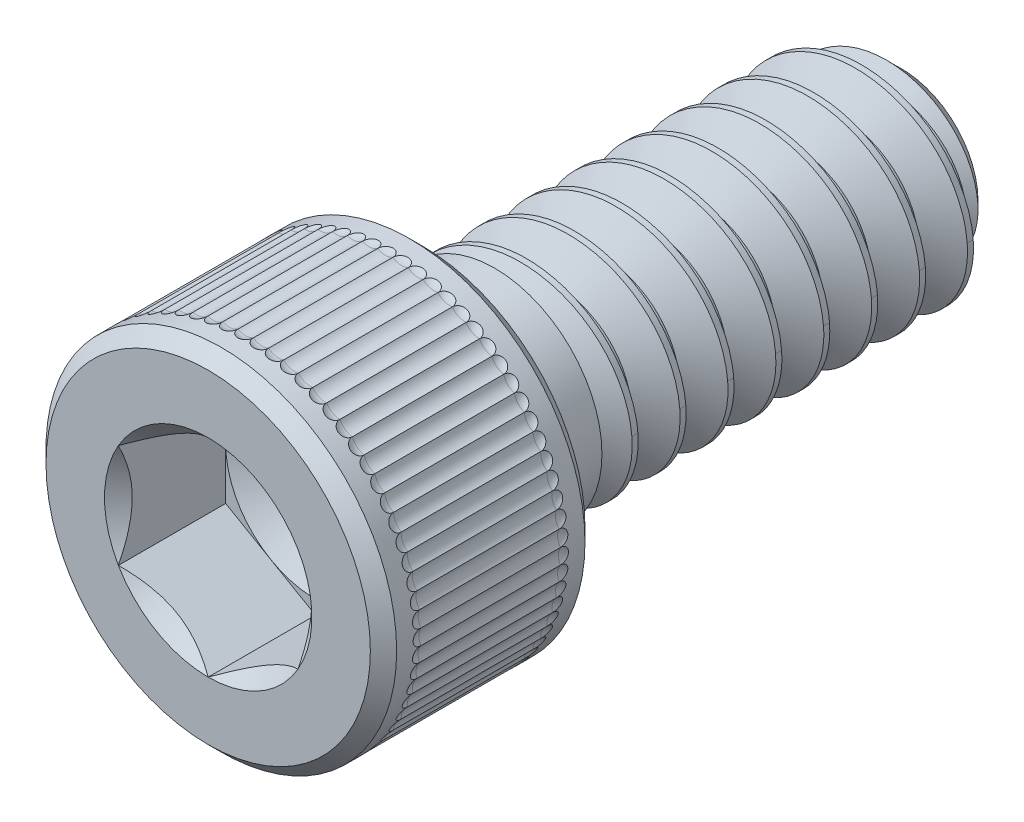
from build123d import *
from build123d.topology import SkipClean

# Parameters (mm, degrees)
CUT_EXTRUDE1_DEPTH = 1.4224
CUT_SWEEP1_PITCH   = 0.635
CIRPATTERN1_COUNT  = 72


with BuildPart() as part:
    # Sketch2 → Revolve1 (revolve)
    with BuildSketch(Plane(origin=(0, 0, 0), x_dir=(0, 0, -1), z_dir=(1, 0, 0)), mode=Mode.PRIVATE) as revolve1_sk:
        with BuildLine():
            Line((-1.9269075, 2.3241), (-1.7526, 2.1497925))
            Line((-1.7526, 2.1497925), (-1.7526, 1.56464))
            ThreePointArc((-1.7526, 1.56464), (-1.710938869, 1.464061131), (-1.61036, 1.4224))
            Line((-1.61036, 1.4224), (4.184955401, 1.4224))
            Line((4.184955401, 1.4224), (4.5974, 1.009955401))
            Line((4.5974, 1.009955401), (4.5974, 0))
            Line((4.5974, 0), (-3.175, 0))
            Line((-3.175, 0), (-3.175, 1.190625))
            Line((-3.175, 1.190625), (-4.5974, 1.190625))
            Line((-4.5974, 1.190625), (-4.5974, 2.1497925))
            Line((-4.5974, 2.1497925), (-4.4230925, 2.3241))
            Line((-4.4230925, 2.3241), (-1.9269075, 2.3241))
        make_face()
    revolve(revolve1_sk.sketch.rotate(Axis((0, 0, 3.175), (0, 0, -1)), 90), axis=Axis((0, 0, 3.175), (0, 0, -1)))

    # Sketch3 → Cut-Extrude1 (cut)
    with BuildSketch(Plane.XY.offset(4.5974)):
        Polygon((0, 1.374815329), (-1.190625, 0.687407664), (-1.190625, -0.687407664), (0, -1.374815329), (1.190625, -0.687407664), (1.190625, 0.687407664), align=None)
    extrude(amount=-CUT_EXTRUDE1_DEPTH, mode=Mode.SUBTRACT)

    # Cut-Extrude2 cone 1 section (through the dimple's axis) → Cut-Extrude2 (revolve, cut)
    with BuildSketch(Plane(origin=(0, 0, 4.5974), x_dir=(0, -1, 0), z_dir=(1, 0, 0))):
        Polygon((0, 0), (1.374815329, 0), (0, 1.374815329), align=None)
    revolve(axis=Axis((0, 0, 4.5974), (0, 0, -1)), mode=Mode.SUBTRACT)

    # Cut-Extrude5 cone 1 section (through the dimple's axis) → Cut-Extrude5 (revolve, cut)
    with BuildSketch(Plane(origin=(0, 0, 3.175), x_dir=(0, -1, 0), z_dir=(1, 0, 0))):
        Polygon((0, 0), (1.190625, 0), (0, 0.687407664), align=None)
    revolve(axis=Axis((0, 0, 3.175), (0, 0, -1)), mode=Mode.SUBTRACT)

    # Cut-Sweep1: the profile of Sketch8 screwed along a right-hand helix of 10.625 turns, 6 arcs to a turn; built about Z, then put on its axis
    cut_sweep1_z = Axis((0, 0, 0), (0, 0, 1))
    cut_sweep1_corners = [(1.456770383, 0, 0.01984375), (1.456770383, 0, -0.57546875), (1.009955401, 0, -0.3175), (1.009955401, 0, -0.238125)]
    with BuildLine(mode=Mode.PRIVATE) as cut_sweep1_profile:
        Line(cut_sweep1_corners[0], cut_sweep1_corners[1])
        Line(cut_sweep1_corners[1], cut_sweep1_corners[2])
        Line(cut_sweep1_corners[2], cut_sweep1_corners[3])
        Line(cut_sweep1_corners[3], cut_sweep1_corners[0])
    cut_sweep1_cap = Face(cut_sweep1_profile.wire())
    cut_sweep1_turn_angles = [0, 30, 60, 90, 120, 150, 180, 210, 240, 270, 300, 330, 360]
    cut_sweep1_turn_weights = [1, 0.8660254037844387, 1, 0.8660254037844387, 1, 0.8660254037844387, 1, 0.8660254037844387, 1, 0.8660254037844387, 1, 0.8660254037844387, 1]
    cut_sweep1_turn_rails = [Edge.make_bspline([Vector(p[0], p[1], 0).rotate(cut_sweep1_z, cut_sweep1_turn_angles[k]) / cut_sweep1_turn_weights[k] + Vector(0, 0, p[2] + CUT_SWEEP1_PITCH * cut_sweep1_turn_angles[k] / 360) for k in range(13)], [0, 0, 0, 1, 1, 2, 2, 3, 3, 4, 4, 5, 5, 6, 6, 6], 2, cut_sweep1_turn_weights) for p in cut_sweep1_corners]
    cut_sweep1_turn_sides = [Face.make_surface_from_curves(cut_sweep1_turn_rails[p[0]], cut_sweep1_turn_rails[p[1]]) for p in [(0, 1), (1, 2), (2, 3), (3, 0)]]
    cut_sweep1_last_angles = [3600, 3630, 3660, 3690, 3720, 3750, 3780, 3802.5, 3825]
    cut_sweep1_last_weights = [1, 0.8660254037844387, 1, 0.8660254037844387, 1, 0.8660254037844387, 1, 0.9238795325112503, 1]
    cut_sweep1_last_rails = [Edge.make_bspline([Vector(p[0], p[1], 0).rotate(cut_sweep1_z, cut_sweep1_last_angles[k]) / cut_sweep1_last_weights[k] + Vector(0, 0, p[2] + CUT_SWEEP1_PITCH * cut_sweep1_last_angles[k] / 360) for k in range(9)], [0, 0, 0, 1, 1, 2, 2, 3, 3, 4, 4, 4], 2, cut_sweep1_last_weights) for p in cut_sweep1_corners]
    cut_sweep1_last_sides = [Face.make_surface_from_curves(cut_sweep1_last_rails[p[0]], cut_sweep1_last_rails[p[1]]) for p in [(0, 1), (1, 2), (2, 3), (3, 0)]]
    cut_sweep1 = Plane(origin=(0, 0, -4.5974), x_dir=(0, 1, 0), z_dir=(0, 0, 1)) * Solid(Shell([*[p.moved(Location((0, 0, CUT_SWEEP1_PITCH * i))) for i in range(10) for p in cut_sweep1_turn_sides], *cut_sweep1_last_sides, cut_sweep1_cap, cut_sweep1_cap.rotate(cut_sweep1_z, 3825).moved(Location((0, 0, CUT_SWEEP1_PITCH * 3825 / 360)))]))
    add(cut_sweep1, mode=Mode.SUBTRACT)

    # Sketch9 → Revolve2 (revolve)
    with SkipClean():  # the faces are left unmerged after this step: merging them gives an invalid solid
        with BuildSketch(Plane(origin=(0, 0, 0), x_dir=(0, 0, -1), z_dir=(1, 0, 0)), mode=Mode.PRIVATE) as revolve2_sk:
            with BuildLine():
                Line((-2.1891625, 0), (-2.1891625, 1.56464))
                Line((-2.1891625, 1.56464), (-1.7526, 1.56464))
                ThreePointArc((-1.7526, 1.56464), (-1.710938869, 1.464061131), (-1.61036, 1.4224))
                Line((-1.61036, 1.4224), (-0.8001, 1.4224))
                Line((-0.8001, 1.4224), (0.021123023, 0))
                Line((0.021123023, 0), (-2.1891625, 0))
            make_face()
        revolve(revolve2_sk.sketch.rotate(Axis((0, 0, -0.021123023), (0, 0, 1)), 270), axis=Axis((0, 0, -0.021123023), (0, 0, 1)))

    # Sketch12 → Cut-Revolve1 (revolve, cut)
    with SkipClean():  # the faces are left unmerged after this step: merging them gives an invalid solid
        with BuildSketch(Plane(origin=(0, 0, 0), x_dir=(0, 0, -1), z_dir=(1, 0, 0))):
            with BuildLine():
                Line((-4.09956, 2.294724403), (-2.25044, 2.294724403))
                ThreePointArc((-2.25044, 2.294724403), (-2.107072943, 2.354108983), (-2.047688364, 2.49747604))
                Line((-2.047688364, 2.49747604), (-4.302311636, 2.49747604))
                ThreePointArc((-4.302311636, 2.49747604), (-4.242927057, 2.354108983), (-4.09956, 2.294724403))
            make_face()
        cut_revolve1 = revolve(axis=Axis((0, 2.49747604, 4.302311636), (0, 0, -1)), mode=Mode.SUBTRACT)

    # CirPattern1: Cut-Revolve1 ×72 about axis
    with SkipClean():  # the faces are left unmerged after this step: merging them gives an invalid solid
        cirpattern1_axis = Axis((0, 0, 0), (0, 0, 1))
        for i in range(1, CIRPATTERN1_COUNT):
            add(cut_revolve1.rotate(cirpattern1_axis, i * 360 / CIRPATTERN1_COUNT), mode=Mode.SUBTRACT)


solid = part.part
